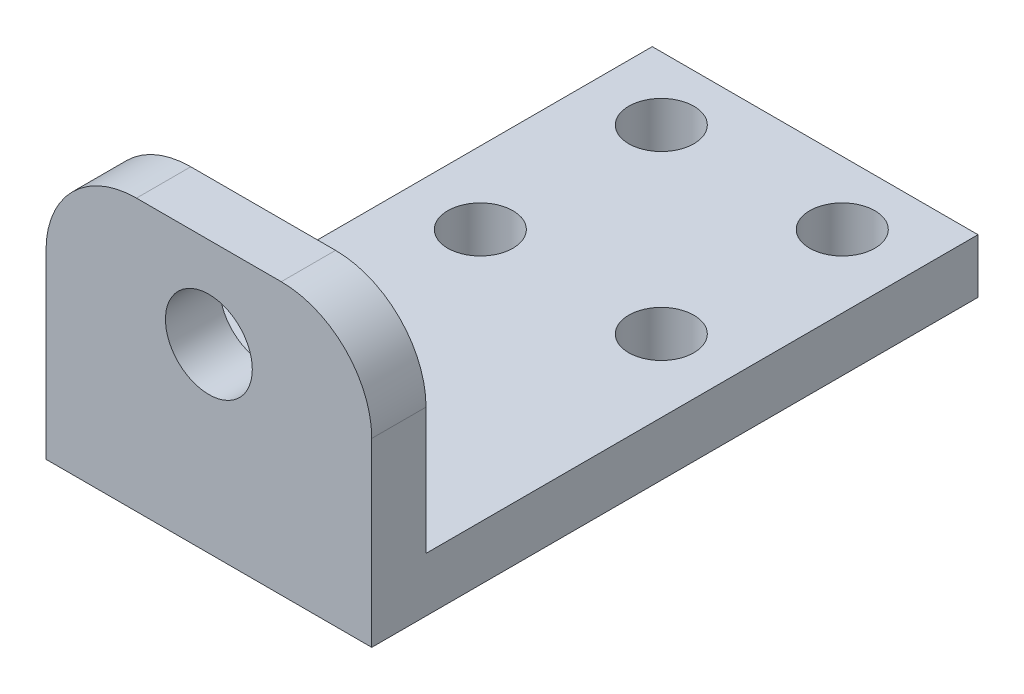
from build123d import *

# Parameters (mm, degrees)
BOSS_EXTRUDE1_DEPTH      = 18
M4_CLEARANCE_HOLE1_D     = 4.8
M4_CLEARANCE_HOLE1_DEPTH = 3
M4_CLEARANCE_HOLE1_TIP   = 1.442065486
FILLET1_R                = 5
M3_CLEARANCE_HOLE1_D     = 3.6


with BuildPart() as part:
    # Sketch1 → Boss-Extrude1 (new body)
    with BuildSketch(Plane(origin=(0, 0, 0), x_dir=(0, 0, -1), z_dir=(1, 0, 0))):
        Polygon((0, 0), (33.5, 0), (33.5, 3), (3, 3), (3, 15), (0, 15), align=None)
    extrude(amount=BOSS_EXTRUDE1_DEPTH)

    # M4 Clearance Hole1
    with Locations(Plane.XY):
        with Locations((9, 10)):
            Hole(M4_CLEARANCE_HOLE1_D / 2, depth=M4_CLEARANCE_HOLE1_DEPTH)
            with Locations((0, 0, -(M4_CLEARANCE_HOLE1_DEPTH + M4_CLEARANCE_HOLE1_TIP / 2))):  # 118° drill point
                Cone(0, M4_CLEARANCE_HOLE1_D / 2, M4_CLEARANCE_HOLE1_TIP, mode=Mode.SUBTRACT)

    # Fillet1
    fillet1_edges = [part.edges().sort_by_distance(p)[0] for p in [
        (0, 15, -1.5),
        (18, 15, -1.5),
    ]]
    fillet(fillet1_edges, radius=FILLET1_R)

    # M3 Clearance Hole1 (through all)
    with Locations(Plane(origin=(0, 3, 0), x_dir=(1, 0, 0), z_dir=(0, 1, 0))):
        with Locations((14, 30), (4, 30), (4, 20), (14, 20)):
            Hole(M3_CLEARANCE_HOLE1_D / 2)


solid = part.part
